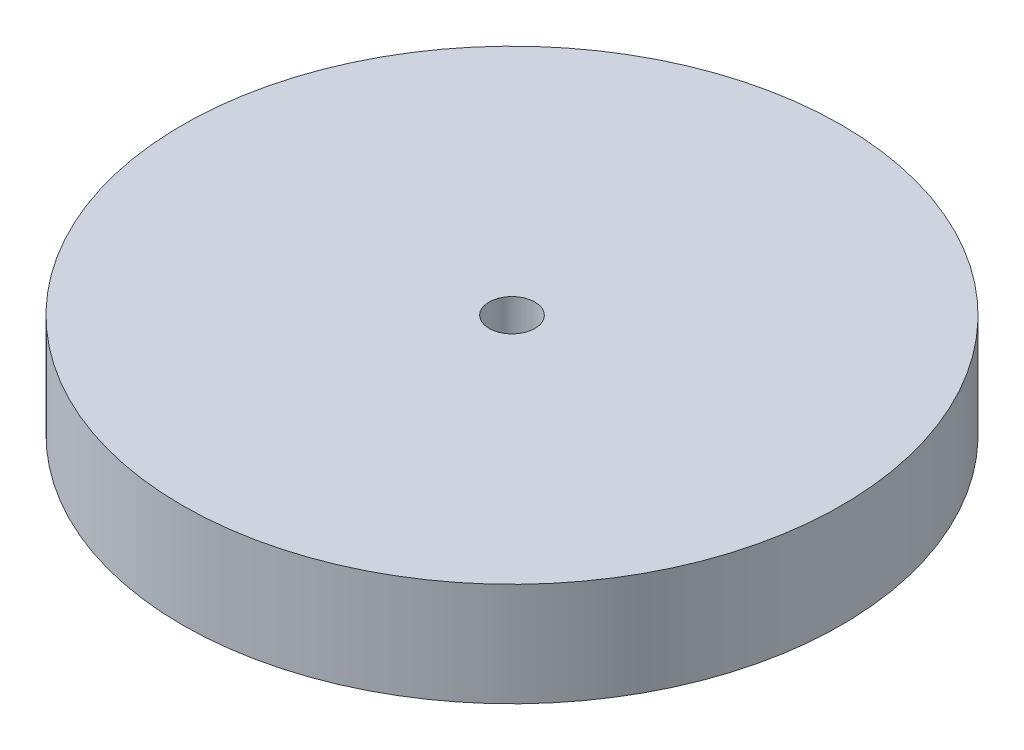
from build123d import *

# Parameters (mm, degrees)
SKETCH1_R           = 60.5
BOSS_EXTRUDE1_DEPTH = 19
SKETCH2_R           = 4.2
CUT_EXTRUDE2_DEPTH  = 88.644166948


with BuildPart() as part:
    # Sketch1 → Boss-Extrude1 (new body)
    with BuildSketch(Plane(origin=(0, 0, 0), x_dir=(1, 0, 0), z_dir=(0, 1, 0))):
        Circle(SKETCH1_R)
    extrude(amount=BOSS_EXTRUDE1_DEPTH)

    # Sketch2 → Cut-Extrude2 (cut, through all)
    with BuildSketch(Plane(origin=(0, 19, 0), x_dir=(1, 0, 0), z_dir=(0, 1, 0))):
        Circle(SKETCH2_R)
    extrude(amount=-CUT_EXTRUDE2_DEPTH, mode=Mode.SUBTRACT)


solid = part.part
